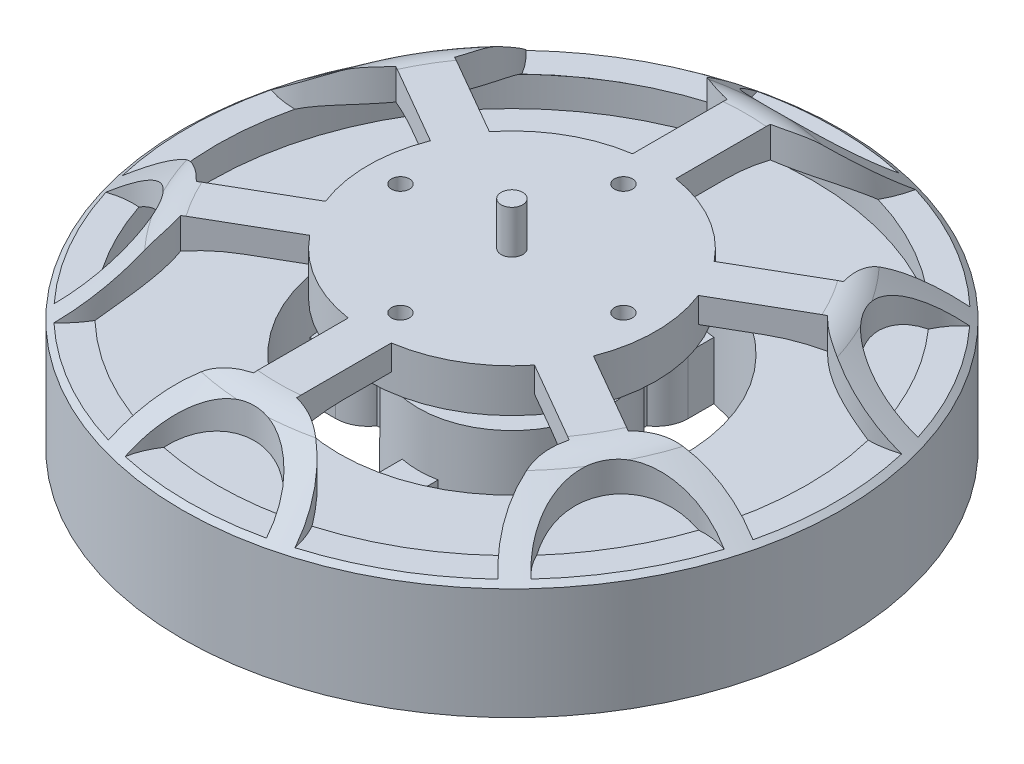
from build123d import *

# Parameters (mm, degrees)
M4X0_7_TAPPED_HOLE1_D     = 3.3
M4X0_7_TAPPED_HOLE1_DEPTH = 8.0000094
M4X0_7_TAPPED_HOLE1_TIP   = 0.9914200213954745
CUT_EXTRUDE1_DEPTH        = 8
CUT_EXTRUDE3_START        = 32.18
SKETCH6_OUTSIDE_W         = 120.686
SKETCH6_OUTSIDE_H         = 120.686
CUT_EXTRUDE3_DEPTH        = 8
M3X0_5_TAPPED_HOLE1_D     = 2.5
M3X0_5_TAPPED_HOLE1_DEPTH = 6


with BuildPart() as part:
    # Sketch1 → Revolve1 (revolve)
    with BuildSketch(Plane.XY, mode=Mode.PRIVATE) as revolve1_sk:
        with BuildLine():
            Line((0, 0), (9.650000000000006, 0))
            Line((9.650000000000006, 0), (9.650000000000006, 3.93))
            Line((9.650000000000006, 3.93), (27.500000000000004, 3.930000000000003))
            Line((27.500000000000004, 3.930000000000003), (45.83000000000004, 8.08))
            Line((45.83000000000004, 8.08), (45.83000000000001, 23.580000000000002))
            Line((45.83000000000001, 23.580000000000002), (36.13217014567859, 30.955703093036792))
            ThreePointArc((36.13217014567859, 30.955703093036792), (34.416478729568794, 31.865693385956583), (32.5, 32.18))
            Line((32.5, 32.18), (1.5000000000000007, 32.17999999999999))
            Line((1.5000000000000007, 32.17999999999999), (1.5000000000000004, 38.17999999999999))
            Line((1.5000000000000004, 38.17999999999999), (0, 38.17999999999999))
            Line((0, 38.17999999999999), (0, 0))
        make_face()
    revolve(revolve1_sk.sketch.rotate(Axis((0, 38.17999999999999, 0), (0, -1, 0)), 90), axis=Axis((0, 38.17999999999999, 0), (0, -1, 0)))

    # M4x0.7 Tapped Hole1
    with Locations(Plane(origin=(-20, 3.93, 0), x_dir=(0, 0, -1), z_dir=(0, -1, 0))):
        with Locations((0, 0), (-20, 20), (0, 40), (20, 20)):
            Hole(M4X0_7_TAPPED_HOLE1_D / 2, depth=M4X0_7_TAPPED_HOLE1_DEPTH)
            with Locations((0, 0, -(M4X0_7_TAPPED_HOLE1_DEPTH + M4X0_7_TAPPED_HOLE1_TIP / 2))):  # 118° drill point
                Cone(0, M4X0_7_TAPPED_HOLE1_D / 2, M4X0_7_TAPPED_HOLE1_TIP, mode=Mode.SUBTRACT)

    # Sketch2 → Cut-Extrude1 (cut)
    with BuildSketch(Plane.XZ.offset(-3.930000000000001)):
        with BuildLine():
            Line((2.5, 12.757350857838786), (2.5, 16.25834261322606))
            ThreePointArc((2.5, 16.25834261322606), (3.968626966596886, 17.878679656440358), (4.5, 20))
            Line((4.5, 20), (4.500000000000001, 23.5743504743609))
            ThreePointArc((4.500000000000001, 23.5743504743609), (16.97056275271981, 16.970562752719754), (23.574350474360912, 4.4999999999999245))
            Line((23.574350474360912, 4.4999999999999245), (20.000000000000018, 4.499999999999934))
            ThreePointArc((20.000000000000018, 4.499999999999934), (17.87867965644037, 3.9686269665968266), (16.258342613226063, 2.4999999999999467))
            Line((16.258342613226063, 2.4999999999999467), (12.757350857838793, 2.4999999999999587))
            ThreePointArc((12.757350857838793, 2.4999999999999587), (9.19238818017387, 9.19238818017384), (2.5, 12.757350857838786))
        make_face()
        with BuildLine():
            Line((19.999999999999982, -4.500000000000068), (23.5743504743609, -4.499999999999999))
            ThreePointArc((23.5743504743609, -4.499999999999999), (16.970562752719754, -16.97056275271981), (4.499999999999926, -23.574350474360912))
            Line((4.499999999999926, -23.574350474360912), (4.499999999999864, -20.000000000000032))
            ThreePointArc((4.499999999999864, -20.000000000000032), (3.9686269665967657, -17.878679656440383), (2.49999999999989, -16.25834261322607))
            Line((2.49999999999989, -16.25834261322607), (2.4999999999999596, -12.757350857838793))
            ThreePointArc((2.4999999999999596, -12.757350857838793), (9.19238818017384, -9.19238818017387), (12.757350857838786, -2.499999999999999))
            Line((12.757350857838786, -2.499999999999999), (16.25834261322605, -2.500000000000055))
            ThreePointArc((16.25834261322605, -2.500000000000055), (17.87867965644034, -3.9686269665969456), (19.999999999999982, -4.500000000000068))
        make_face()
        with BuildLine():
            Line((-4.500000000000139, -19.999999999999968), (-4.499999999999998, -23.5743504743609))
            ThreePointArc((-4.499999999999998, -23.5743504743609), (-16.9705627527198, -16.97056275271976), (-23.574350474360912, -4.499999999999927))
            Line((-23.574350474360912, -4.499999999999927), (-20.00000000000005, -4.499999999999794))
            ThreePointArc((-20.00000000000005, -4.499999999999794), (-17.8786796564404, -3.9686269665967018), (-16.25834261322608, -2.499999999999832))
            Line((-16.25834261322608, -2.499999999999832), (-12.757350857838793, -2.4999999999999605))
            ThreePointArc((-12.757350857838793, -2.4999999999999605), (-9.19238818017387, -9.19238818017384), (-2.4999999999999982, -12.757350857838786))
            Line((-2.4999999999999982, -12.757350857838786), (-2.5000000000001137, -16.25834261322604))
            ThreePointArc((-2.5000000000001137, -16.25834261322604), (-3.968626966597011, -17.87867965644033), (-4.500000000000139, -19.999999999999968))
        make_face()
        with BuildLine():
            Line((-19.99999999999995, 4.50000000000021), (-23.5743504743609, 4.4999999999999964))
            ThreePointArc((-23.5743504743609, 4.4999999999999964), (-16.970562752719758, 16.970562752719808), (-4.499999999999929, 23.574350474360912))
            Line((-4.499999999999929, 23.574350474360912), (-4.499999999999725, 20.000000000000068))
            ThreePointArc((-4.499999999999725, 20.000000000000068), (-3.9686269665966414, 17.878679656440415), (-2.499999999999776, 16.25834261322609))
            Line((-2.499999999999776, 16.25834261322609), (-2.499999999999961, 12.757350857838793))
            ThreePointArc((-2.499999999999961, 12.757350857838793), (-9.192388180173841, 9.192388180173868), (-12.757350857838786, 2.499999999999998))
            Line((-12.757350857838786, 2.499999999999998), (-16.25834261322603, 2.5000000000001705))
            ThreePointArc((-16.25834261322603, 2.5000000000001705), (-17.878679656440312, 3.968626966597072), (-19.99999999999995, 4.50000000000021))
        make_face()
    extrude(amount=-CUT_EXTRUDE1_DEPTH, mode=Mode.SUBTRACT)

    # Sketch5 → Cut-Revolve3 (revolve, cut)
    with BuildSketch(Plane.XY, mode=Mode.PRIVATE) as cut_revolve3_sk:
        with BuildLine():
            Line((24.000000006, 19.430000000000003), (41.83000000000002, 19.430000000000003))
            Line((41.83000000000002, 19.430000000000003), (41.83000000000002, 23.580000000000002))
            ThreePointArc((41.83000000000002, 23.580000000000002), (34.683019416781995, 27.370706704799655), (26.699627916557798, 28.680000000000003))
            Line((26.699627916557798, 28.680000000000003), (20, 28.68))
            Line((20, 28.68), (20, 26.180000000000003))
            Line((20, 26.180000000000003), (10, 26.180000000000003))
            Line((10, 26.180000000000003), (10, 19.430000000000003))
            Line((10, 19.430000000000003), (13.000000035, 19.430000000000003))
            Line((13.000000035, 19.430000000000003), (13.000000035000001, 11.930000000000001))
            Line((13.000000035000001, 11.930000000000001), (24.000000006, 11.930000000000001))
            Line((24.000000006, 11.930000000000001), (24.000000006, 19.430000000000003))
        make_face()
    revolve(cut_revolve3_sk.sketch.rotate(Axis((0, 40.08899999999999, 0), (0, -1, 0)), 90), axis=Axis((0, 40.08899999999999, 0), (0, -1, 0)), mode=Mode.SUBTRACT)

    # Sketch6 outside → Cut-Extrude3 (cut)
    with BuildSketch(Plane(origin=(0, 0, 0), x_dir=(1, 0, 0), z_dir=(0, 1, 0)).offset(CUT_EXTRUDE3_START)):
        Rectangle(SKETCH6_OUTSIDE_W, SKETCH6_OUTSIDE_H)
        with BuildLine():
            Line((-3, 19.773719933285186), (-3.000000000000002, 32.924090500859705))
            ThreePointArc((-3.000000000000002, 32.924090500859705), (-9.751293330444847, 36.85922643337702), (-13.110830290047499, 43.914633427885676))
            ThreePointArc((-13.110830290047499, 43.914633427885676), (-11.532937881410842, 44.35516028404722), (-9.940309061269474, 44.73901156447742))
            ThreePointArc((-9.940309061269474, 44.73901156447742), (2.83e-15, 35.83000000000001), (9.94030906126947, 44.73901156447743))
            ThreePointArc((9.94030906126947, 44.73901156447743), (11.532937881410836, 44.35516028404722), (13.110830290047499, 43.914633427885676))
            ThreePointArc((13.110830290047499, 43.914633427885676), (9.751293330444845, 36.85922643337702), (3.0000000000000004, 32.924090500859705))
            Line((3.0000000000000004, 32.924090500859705), (3, 19.773719933285186))
            ThreePointArc((3, 19.773719933285186), (9.999999999999996, 17.32050807568877), (15.624543789543704, 12.484936177995912))
            Line((15.624543789543704, 12.484936177995912), (27.013098770242472, 19.060121461783112))
            ThreePointArc((27.013098770242472, 19.060121461783112), (27.045379789925015, 26.874480960607457), (31.475773001406623, 33.31162880983041))
            ThreePointArc((31.475773001406623, 33.31162880983041), (32.646226654210146, 32.165397327593205), (33.77496602440857, 30.97806595076665))
            ThreePointArc((33.77496602440857, 30.97806595076665), (31.02969021759649, 17.91499999999994), (43.715275085678, 13.76094561371061))
            ThreePointArc((43.715275085678, 13.76094561371061), (44.179164535620934, 12.189762956453844), (44.58660329145407, 10.603004618055104))
            ThreePointArc((44.58660329145407, 10.603004618055104), (36.79667312036983, 9.984745472769427), (30.01309877024246, 13.86396903907647))
            Line((30.01309877024246, 13.86396903907647), (18.624543789543704, 7.28878375528928))
            ThreePointArc((18.624543789543704, 7.28878375528928), (19.999999999999996, 4.44e-15), (18.624543789543715, -7.288783755289274))
            Line((18.624543789543715, -7.288783755289274), (30.013098770242372, -13.863969039076675))
            ThreePointArc((30.013098770242372, -13.863969039076675), (36.79667312036977, -9.98474547276968), (44.586603291454004, -10.60300461805541))
            ThreePointArc((44.586603291454004, -10.60300461805541), (44.179164535620856, -12.189762956454144), (43.715275085677916, -13.760945613710907))
            ThreePointArc((43.715275085677916, -13.760945613710907), (31.02969021759637, -17.91500000000015), (33.774966024408364, -30.978065950766887))
            ThreePointArc((33.774966024408364, -30.978065950766887), (32.646226654209926, -32.16539732759343), (31.475773001406402, -33.31162880983062))
            ThreePointArc((31.475773001406402, -33.31162880983062), (27.045379789924844, -26.874480960607645), (27.013098770242344, -19.0601214617833))
            Line((27.013098770242344, -19.0601214617833), (15.624543789543713, -12.484936177995909))
            ThreePointArc((15.624543789543713, -12.484936177995909), (10.000000000000004, -17.320508075688775), (3.0000000000000027, -19.773719933285186))
            Line((3.0000000000000027, -19.773719933285186), (2.999999999999772, -32.92409050085973))
            ThreePointArc((2.999999999999772, -32.92409050085973), (9.751293330444588, -36.85922643337708), (13.110830290047192, -43.91463342788576))
            ThreePointArc((13.110830290047192, -43.91463342788576), (11.53293788141052, -44.355160284047294), (9.940309061269161, -44.739011564477494))
            ThreePointArc((9.940309061269161, -44.739011564477494), (-2.5502e-13, -35.83000000000001), (-9.940309061269783, -44.739011564477366))
            ThreePointArc((-9.940309061269783, -44.739011564477366), (-11.532937881411149, -44.35516028404715), (-13.110830290047806, -43.91463342788558))
            ThreePointArc((-13.110830290047806, -43.91463342788558), (-9.751293330445103, -36.859226433376946), (-3.0000000000002305, -32.924090500859684))
            Line((-3.0000000000002305, -32.924090500859684), (-2.9999999999999973, -19.773719933285186))
            ThreePointArc((-2.9999999999999973, -19.773719933285186), (-9.999999999999995, -17.32050807568877), (-15.624543789543704, -12.484936177995918))
            Line((-15.624543789543704, -12.484936177995918), (-27.013098770242603, -19.06012146178292))
            ThreePointArc((-27.013098770242603, -19.06012146178292), (-27.045379789925214, -26.874480960607258), (-31.47577300140686, -33.311628809830175))
            ThreePointArc((-31.47577300140686, -33.311628809830175), (-32.64622665421035, -32.165397327592984), (-33.774966024408776, -30.97806595076641))
            ThreePointArc((-33.774966024408776, -30.97806595076641), (-31.02969021759661, -17.91499999999971), (-43.7152750856781, -13.760945613710302))
            ThreePointArc((-43.7152750856781, -13.760945613710302), (-44.17916453562102, -12.189762956453531), (-44.58660329145414, -10.603004618054786))
            ThreePointArc((-44.58660329145414, -10.603004618054786), (-36.796673120369896, -9.984745472769163), (-30.013098770242557, -13.863969039076256))
            Line((-30.013098770242557, -13.863969039076256), (-18.624543789543704, -7.288783755289287))
            ThreePointArc((-18.624543789543704, -7.288783755289287), (-20, -1.133e-14), (-18.624543789543715, 7.288783755289263))
            Line((-18.624543789543715, 7.288783755289263), (-30.01309877024227, 13.863969039076881))
            ThreePointArc((-30.01309877024227, 13.863969039076881), (-36.7966731203697, 9.98474547276993), (-44.586603291453926, 10.60300461805572))
            ThreePointArc((-44.586603291453926, 10.60300461805572), (-44.17916453562077, 12.189762956454452), (-43.71527508567781, 13.76094561371121))
            ThreePointArc((-43.71527508567781, 13.76094561371121), (-31.029690217596237, 17.915000000000365), (-33.774966024408144, 30.978065950767114))
            ThreePointArc((-33.774966024408144, 30.978065950767114), (-32.646226654209705, 32.16539732759365), (-31.475773001406157, 33.311628809830836))
            ThreePointArc((-31.475773001406157, 33.311628809830836), (-27.045379789924645, 26.87448096060782), (-27.013098770242205, 19.06012146178348))
            Line((-27.013098770242205, 19.06012146178348), (-15.624543789543718, 12.484936177995898))
            ThreePointArc((-15.624543789543718, 12.484936177995898), (-10.000000000000002, 17.320508075688767), (-3, 19.773719933285186))
        make_face(mode=Mode.SUBTRACT)
    extrude(amount=-CUT_EXTRUDE3_DEPTH, mode=Mode.SUBTRACT)

    # M3x0.5 Tapped Hole1
    with Locations(Plane(origin=(0, 32.18, 0), x_dir=(1, 0, 0), z_dir=(0, 1, 0))):
        with Locations((0, 15.5), (15.5, 0), (0, -15.5), (-15.5, 0)):
            Hole(M3X0_5_TAPPED_HOLE1_D / 2, depth=M3X0_5_TAPPED_HOLE1_DEPTH)


solid = part.part
